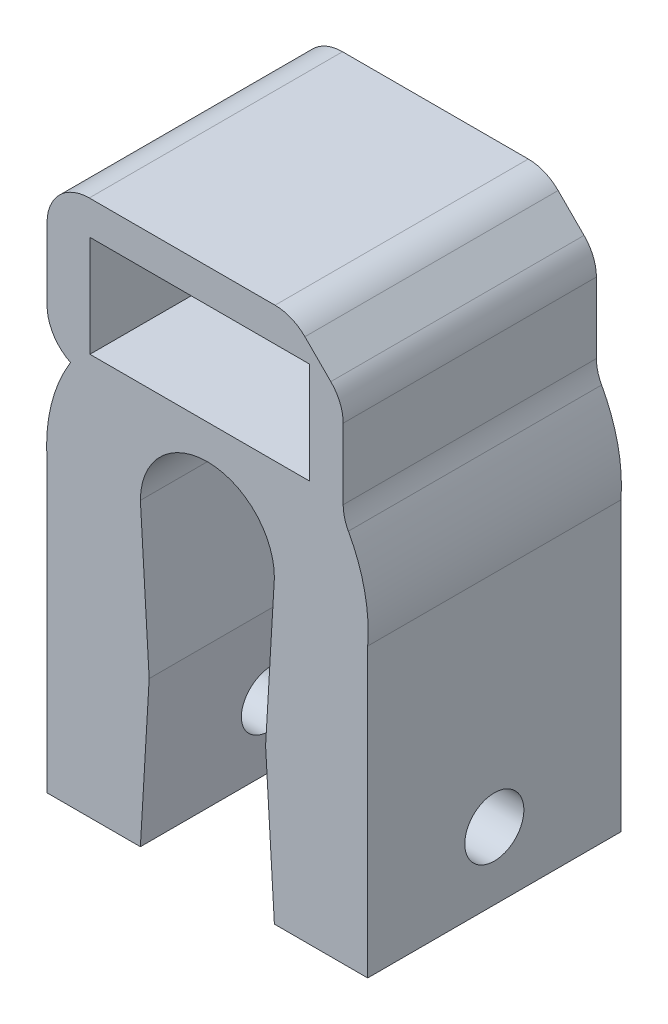
from build123d import *

# Parameters (mm, degrees)
CLIP_DEPTH          = 15
SKETCH7_R           = 1.75
CUT_EXTRUDE4_DEPTH  = 19.812
SKETCH8_W           = 17.539999972
SKETCH8_H           = 9.000000002
BOSS_EXTRUDE1_DEPTH = 15
SKETCH10_W          = 13
SKETCH10_H          = 6
CUT_EXTRUDE5_DEPTH  = 15
CHAMFER2_SIZE       = 3
FILLET1_R           = 2.5


with BuildPart() as part:
    # Sketch1 → Clip (new body)
    with BuildSketch(Plane(origin=(0, -100, 100), x_dir=(1, 0, 0), z_dir=(0, 0, -1))):
        with BuildLine():
            Line((-3.447825682, -91.120916541), (-3.96875, -100))
            ThreePointArc((-3.96875, -100), (0, -103.96875), (3.96875, -100))
            Line((3.96875, -100), (3.447825682, -91.120916541))
            Line((3.447825682, -91.120916541), (3.96875, -82.230916541))
            Line((3.96875, -82.230916541), (9.496072463, -82.230916541))
            Line((9.496072463, -82.230916541), (9.496072463, -99.258223228))
            ThreePointArc((9.496072463, -99.258223228), (0, -109.525), (-9.496072463, -99.258223228))
            Line((-9.496072463, -99.258223228), (-9.496072463, -82.230916541))
            Line((-9.496072463, -82.230916541), (-3.96875, -82.230916541))
            Line((-3.96875, -82.230916541), (-3.447825682, -91.120916541))
        make_face()
    extrude(amount=CLIP_DEPTH)

    # Sketch7 → Cut-Extrude4 (cut)
    with BuildSketch(Plane.ZY.offset(9.496072463)):
        with Locations(Location((92.5, -13.769083459, 0), (0, 0, 270))):
            Circle(SKETCH7_R)
    extrude(amount=-CUT_EXTRUDE4_DEPTH, mode=Mode.SUBTRACT)

    # Sketch8 → Boss-Extrude1 (add)
    with BuildSketch(Plane.XY.offset(100)):
        with Locations((-0.726072477, 9.499999907)):
            Rectangle(SKETCH8_W, SKETCH8_H)
    extrude(amount=-BOSS_EXTRUDE1_DEPTH)

    # Sketch10 → Cut-Extrude5 (cut)
    with BuildSketch(Plane(origin=(0, 0, 85), x_dir=(-1, 0, 0), z_dir=(0, 0, -1))):
        with Locations((0.456072491, 8.999999876)):
            Rectangle(SKETCH10_W, SKETCH10_H)
    extrude(amount=-CUT_EXTRUDE5_DEPTH, mode=Mode.SUBTRACT)

    # Chamfer2
    chamfer2_edges = [part.edges().sort_by_distance(p)[0] for p in [
        (8.043927509, 13.999999908, 92.5),
    ]]
    chamfer(chamfer2_edges, length=CHAMFER2_SIZE)

    # Fillet1
    # the kernel refuses this fillet: 2.5 mm, written as the material it adds along each edge
    with BuildSketch(Plane(origin=(8.043927509, 5.101064127, 85), x_dir=(0, 1, 0), z_dir=(0, 0, 1))) as fillet1_piece_1:
        with BuildLine():
            CenterArc((0.68047699, -2.5), FILLET1_R, 90, 28.737235663)
            ThreePointArc((-0.521506611, -0.307915279), (-0.258305429, -0.158103532), (0, 0))
            Line((0, 0), (0.68047699, 0))
        make_face()
    extrude(amount=15)
    # the kernel refuses this fillet: 2.5 mm, written as the material it takes off along each edge
    with BuildSketch(Plane(origin=(-9.496072463, 13.999999908, 106.25), x_dir=(1, 0, 0), z_dir=(0, 0, -1))) as fillet1_2_piece_1:
        with BuildLine():
            CenterArc((FILLET1_R, FILLET1_R), FILLET1_R, 180, 90)
            Line((0, FILLET1_R), (0, 0))
            Line((0, 0), (FILLET1_R, 0))
        make_face()
    extrude(amount=27.5, mode=Mode.SUBTRACT)
    with BuildSketch(Plane(origin=(-9.496072463, 4.999999906, 105.598851266), x_dir=(0, 1, 0), z_dir=(0, 0, -1))) as fillet1_2_piece_2:
        with BuildLine():
            CenterArc((2.239540506, 2.5), FILLET1_R, 206.386538366, 63.613461634)
            Line((0, 1.388938201), (0, 0))
            Line((0, 0), (2.239540506, 0))
        make_face()
    extrude(amount=26.197702531, mode=Mode.SUBTRACT)
    with BuildSketch(Plane(origin=(5.043927509, 13.999999908, 102.588834765), x_dir=(-1, 0, 0), z_dir=(0, 0, -1)), Plane(origin=(8.043927509, 10.999999908, 102.588834765), x_dir=(-0.7071067811865475, 0.7071067811865475, 0), z_dir=(0, 0, -1))) as fillet1_2_piece_3:
        with BuildLine():
            CenterArc((FILLET1_R * 0.414213562373, -FILLET1_R), FILLET1_R, 90, 45)
            Line((-FILLET1_R * 0.292893218813, -FILLET1_R * 0.292893218813), (0, 0))
            Line((0, 0), (FILLET1_R * 0.414213562373, 0))
        make_face()
    extrude(amount=20.17766953, mode=Mode.SUBTRACT)


solid = part.part
